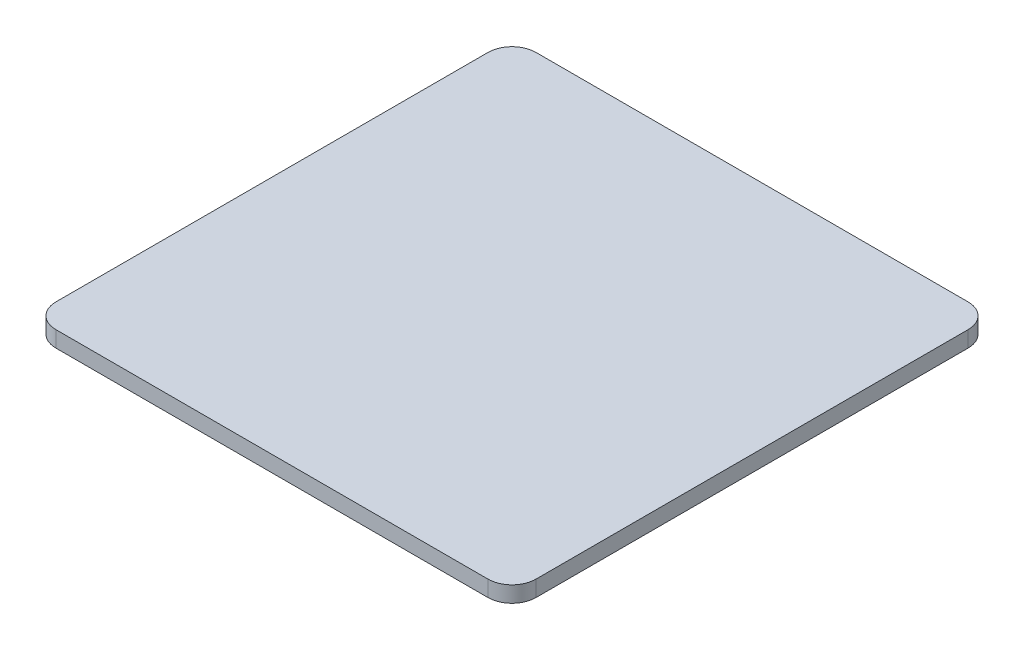
from build123d import *

# Parameters (mm, degrees)
SM_BASE_FLANGE_1_DEPTH = 2


# Sheet-metal steps are written as plain solids
with BuildPart() as part:
    # Sketch 1 → Базовая кромка1 (new body)
    with BuildSketch(Plane(origin=(0, 0, 0), x_dir=(1, 0, 0), z_dir=(0, 1, 0))):
        with BuildLine():
            Line((27, 30), (-27, 30))
            ThreePointArc((-27, 30), (-29.121320344, 29.121320344), (-30, 27))
            Line((-30, 27), (-30, -27))
            ThreePointArc((-30, -27), (-29.121320344, -29.121320344), (-27, -30))
            Line((-27, -30), (27, -30))
            ThreePointArc((27, -30), (29.121320344, -29.121320344), (30, -27))
            Line((30, -27), (30, 27))
            ThreePointArc((30, 27), (29.121320344, 29.121320344), (27, 30))
        make_face()
    extrude(amount=-SM_BASE_FLANGE_1_DEPTH)


solid = part.part
